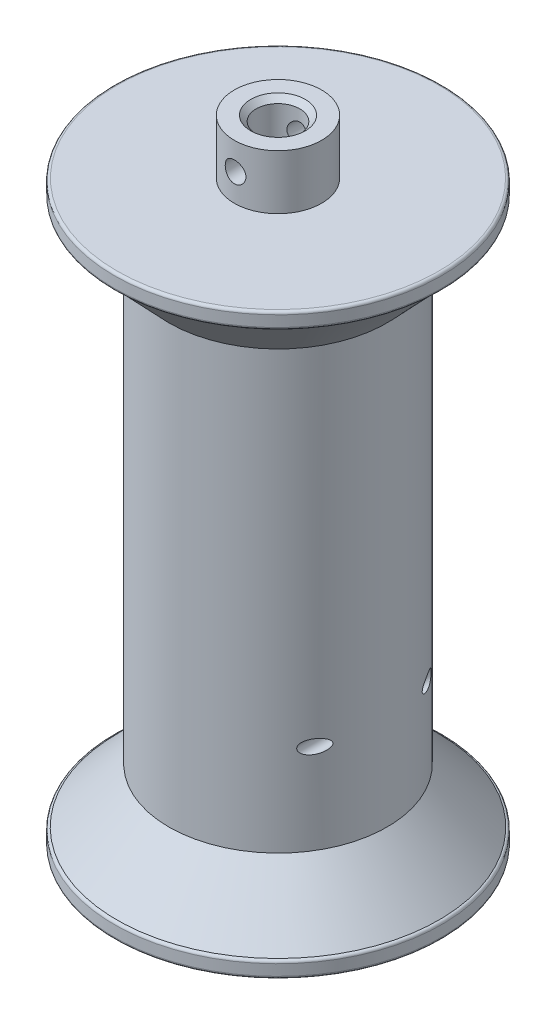
from build123d import *

# Parameters (mm, degrees)
SKETCH_1_R               = 20
EXTRUDE_1_DEPTH          = 100
SKETCH_2_R               = 30
EXTRUDE_2_DEPTH          = 3
EXTRUDE_START            = 3
SKETCH_3_R               = 30
EXTRUDE_3_DEPTH          = 3
CUT_EXTRUDE_1_DEPTH      = 112.39569112
CUT_EXTRUDE_1_DEPTH_BACK = 112.39569112
SKETCH_4_R               = 1.25
SKETCH_6_R               = 8
EXTRUDE_4_DEPTH          = 10
EXTRUDE_START_2          = 10
SKETCH_5_R               = 8
EXTRUDE_5_DEPTH          = 10
CUT_EXTRUDE_2_DEPTH      = 121.702112658
CUT_EXTRUDE_2_DEPTH_BACK = 121.702112658
SKETCH_7_R               = 1.9
SKETCH_8_R               = 4
CUT_EXTRUDE_3_DEPTH      = 133.951118932
CHAMFER_1_SIZE           = 1
FILLET_1_R               = 0.5


with BuildPart() as part:
    # 草图1 → 凸台-拉伸1 (new body)
    with BuildSketch(Plane(origin=(0, 0, 0), x_dir=(1, 0, 0), z_dir=(0, 1, 0))):
        with Locations(Location((0, 0, 0), (0, 0, 270))):
            Circle(SKETCH_1_R)
    extrude(amount=EXTRUDE_1_DEPTH)

    # 草图2 → 凸台-拉伸2 (add)
    with BuildSketch(Plane(origin=(0, 100, 0), x_dir=(1, 0, 0), z_dir=(0, 1, 0))):
        with Locations(Location((0, 0, 0), (0, 0, 270))):
            Circle(SKETCH_2_R)
    extrude(amount=EXTRUDE_2_DEPTH)

    # 草图3 → 凸台-拉伸3 (add)
    with BuildSketch(Plane.XZ.offset(EXTRUDE_START)):
        with Locations(Location((0, 0, 0), (0, 0, 90))):
            Circle(SKETCH_3_R)
    extrude(amount=-EXTRUDE_3_DEPTH)

    # 草图4 → 切除-拉伸1 (cut, two sides: drawn at the far end of the back side and taken through both)
    with BuildSketch(Plane.XY.offset(-CUT_EXTRUDE_1_DEPTH_BACK)):
        with Locations((17, 26.5)):
            Circle(SKETCH_4_R)
    extrude(amount=CUT_EXTRUDE_1_DEPTH + CUT_EXTRUDE_1_DEPTH_BACK, mode=Mode.SUBTRACT)

    # 草图6 → 凸台-拉伸4 (add)
    with BuildSketch(Plane.XZ.offset(3)):
        with Locations(Location((0, 0, 0), (0, 0, 270))):
            Circle(SKETCH_6_R)
    extrude(amount=EXTRUDE_4_DEPTH)

    # 草图5 → 凸台-拉伸5 (add)
    with BuildSketch(Plane(origin=(0, 103, 0), x_dir=(1, 0, 0), z_dir=(0, 1, 0)).offset(EXTRUDE_START_2)):
        with Locations(Location((0, 0, 0), (0, 0, 90))):
            Circle(SKETCH_5_R)
    extrude(amount=-EXTRUDE_5_DEPTH)

    # 草图7 → 切除-拉伸2 (cut, two sides: drawn at the far end of the back side and taken through both)
    with BuildSketch(Plane.XY.offset(-CUT_EXTRUDE_2_DEPTH_BACK)):
        with Locations(Location((0, 108, 0), (0, 0, 90.000000026))):
            Circle(SKETCH_7_R)
        with Locations(Location((0, -8, 0), (0, 0, 269.999999974))):
            Circle(SKETCH_7_R)
    extrude(amount=CUT_EXTRUDE_2_DEPTH + CUT_EXTRUDE_2_DEPTH_BACK, mode=Mode.SUBTRACT)

    # 草图8 → 切除-拉伸3 (cut, through all)
    with BuildSketch(Plane(origin=(0, 113, 0), x_dir=(1, 0, 0), z_dir=(0, 1, 0))):
        with Locations(Location((0, 0, 0), (0, 0, 270))):
            Circle(SKETCH_8_R)
    extrude(amount=-CUT_EXTRUDE_3_DEPTH, mode=Mode.SUBTRACT)

    # 倒角1
    chamfer_1_edges = [part.edges().sort_by_distance(p)[0] for p in [
        (0, -13, -4),
        (0, 113, -4),
    ]]
    chamfer(chamfer_1_edges, length=CHAMFER_1_SIZE)

    # 圆角1
    fillet_1_edges = [part.edges().sort_by_distance(p)[0] for p in [
        (0, 0, -30),
        (0, -3, -30),
        (0, 100, -30),
        (0, 103, -30),
    ]]
    fillet(fillet_1_edges, radius=FILLET_1_R)

    # 倒角2: read off the stored shape, not the designer's step
    # 倒角2 outline → 倒角2 (revolve)
    with BuildSketch(Plane.XY):
        Polygon((20, 100), (20, 90.011911518), (29.523809524, 100.000567215), (29.5, 100.000567215), align=None)
    revolve(axis=Axis((0, 0, 0), (0, 1, 0)))

    # 倒角3: read off the stored shape, not the designer's step
    # 倒角3 outline → 倒角3 (revolve)
    with BuildSketch(Plane.XY):
        Polygon((20, 9.988088482), (20, 0), (29.5, 0), (29.523809524, -0.000567215), align=None)
    revolve(axis=Axis((0, 0, 0), (0, 1, 0)))


solid = part.part
